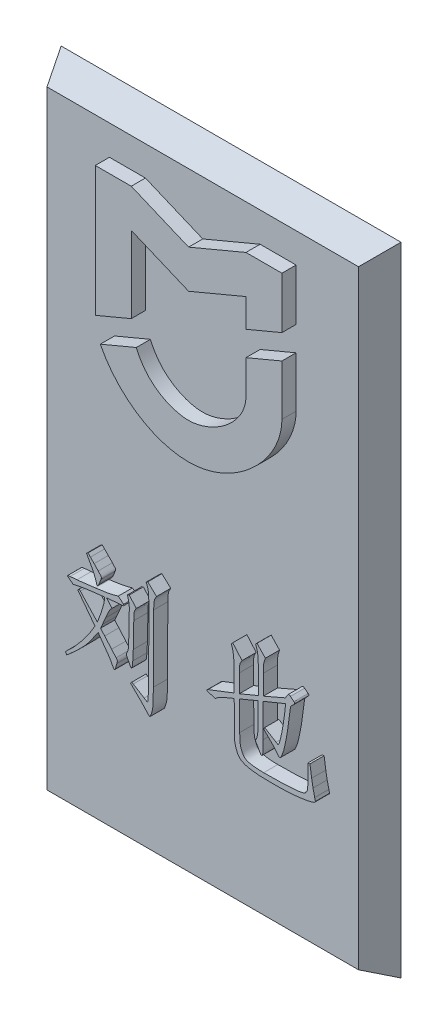
from build123d import *

# Parameters (mm, degrees)
EXTRUDE_2_DEPTH     = 1
EXTRUDE_3_DEPTH     = 1
SKETCH_5_R          = 0.4
CUT_EXTRUDE_1_DEPTH = 1


with BuildPart() as part:
    # 草图1 → 放样1 section 0
    with BuildSketch(Plane.XY):
        with BuildLine():
            Line((-12, -22.5), (12, -22.5))
            Line((12, -22.5), (12, 22.5))
            Line((12, 22.5), (-12, 22.5))
            Line((-12, 22.5), (-12, -22.5))
        make_face()
    # 草图2 → 放样1 section 1
    with BuildSketch(Plane.XY.offset(2)):
        with BuildLine():
            Line((-11, -21.5), (11, -21.5))
            Line((11, -21.5), (11, 21.5))
            Line((11, 21.5), (-11, 21.5))
            Line((-11, 21.5), (-11, -21.5))
        make_face()
    loft()

    # 草图3 → 凸台-拉伸2 (add)
    with BuildSketch(Plane.XY.offset(2)):
        Polygon((-6.59, 10.23382716), (-6.59, 19.4), (-4.05, 19.4), (0, 17.7), (4.05, 19.4), (6.59, 19.4), (6.59, 15.76617284), (4.05, 14.7), (4.05, 16.7), (0, 15), (-4.05, 16.7), (-4.05, 11.3), align=None)
        with BuildLine():
            Line((4.05, 12.964761344), (6.59, 14.030934184))
            Line((6.59, 14.030934184), (6.59, 10.459517091))
            add(Edge.make_bspline(
                [(-6.235218606, 8.64750909), (-4.870751444, 5.947394248), (1.072971475, 2.342935771), (6.59, 7.938736003), (6.59, 10.459517091)],
                knots=[0, 0, 0, 0, 0.499282993, 1, 1, 1, 1], degree=3))
            Line((-6.235218606, 8.64750909), (-3.695218606, 9.713681929))
            add(Edge.make_bspline(
                [(-3.695218606, 9.713681929), (-2.940743033, 7.888143936), (-0.801318312, 7.003787028), (2.044547534, 7.264383406), (4.05, 9.040341702), (4.05, 10.590681389)],
                knots=[0, 0, 0, 0, 0.291621451, 0.391621451, 1, 1, 1, 1], degree=3))
            Line((4.05, 10.590681389), (4.05, 12.964761344))
        make_face()
    extrude(amount=EXTRUDE_2_DEPTH)

    # 草图4 → 凸台-拉伸3 (add)
    with BuildSketch(Plane.XY.offset(2)):
        with BuildLine():
            Line((-8.701981675, -11.388663968), (-8.617600682, -11.301725975))
            add(Edge.make_bspline(
                [(-8.617600682, -11.301725975), (-8.6150409, -11.299171838), (-8.607361553, -11.291509428), (-8.591939025, -11.275812111), (-8.567531532, -11.253359072), (-8.535647603, -11.222146979), (-8.494553267, -11.183979196), (-8.445204463, -11.138285053), (-8.386816782, -11.085481715), (-8.320576955, -11.024306793), (-8.246221878, -10.954193648), (-8.165436054, -10.873388622), (-8.079020214, -10.781225902), (-7.985588416, -10.679014982), (-7.886121691, -10.565894731), (-7.778094687, -10.443997551), (-7.666436292, -10.308719395), (-7.503591424, -10.115000087), (-7.298895179, -9.854174622), (-7.06301416, -9.517669226), (-6.830626913, -9.160132218), (-6.685534688, -8.909472229), (-6.611634349, -8.781802685)],
                knots=[0, 0, 0, 0, 0.067064899, 0.201194698, 0.408053647, 0.681959008, 1.028641223, 1.448132034, 1.929283414, 2.488604495, 3.120354818, 3.824536261, 4.607279378, 5.463251305, 6.392664243, 7.400870751, 8.483674113, 9.645406679, 12.094487374, 14.629448405, 17.264597856, 20, 20, 20, 20], degree=3))
            add(Edge.make_bspline(
                [(-6.611634349, -8.781802685), (-6.677355219, -8.694080325), (-6.801336137, -8.528594101), (-6.975046697, -8.293869871), (-7.128052851, -8.089741633), (-7.260480444, -7.915569528), (-7.369897523, -7.770279599), (-7.457376329, -7.654282983), (-7.526217285, -7.570571896), (-7.582699071, -7.497799136), (-7.635586412, -7.437186854), (-7.679234592, -7.378243521), (-7.712283472, -7.338932475), (-7.724576877, -7.315079833), (-7.729043256, -7.306413808)],
                knots=[0, 0, 0, 0, 2.13149326, 4.021013283, 5.678471046, 7.092298062, 8.275727547, 9.215558715, 9.917047241, 10.382981583, 11.006899411, 11.479347563, 11.810839116, 12, 12, 12, 12], degree=3))
            Line((-7.729043256, -7.306413808), (-7.824930748, -7.177285319))
            Line((-7.824930748, -7.177285319), (-7.729043256, -7.073726827))
            Line((-7.729043256, -7.073726827), (-7.644662263, -7.15938632))
            add(Edge.make_bspline(
                [(-7.644662263, -7.15938632), (-7.629282451, -7.175972122), (-7.591954382, -7.216227229), (-7.527305195, -7.288297956), (-7.440557184, -7.379422665), (-7.302378255, -7.536292511), (-7.104572099, -7.745740062), (-6.905065826, -7.963796689), (-6.747802954, -8.136718021), (-6.635049858, -8.252099447), (-6.536865705, -8.358806964), (-6.47286159, -8.423973045), (-6.442872363, -8.454506712)],
                knots=[0, 0, 0, 0, 0.384045172, 0.932109217, 1.643764177, 2.519898478, 4.481024401, 6.534588103, 7.538259206, 8.449228042, 9.273383417, 10, 10, 10, 10], degree=3))
            add(Edge.make_bspline(
                [(-6.442872363, -8.454506712), (-6.405201527, -8.35911478), (-6.332905522, -8.176043302), (-6.231843181, -7.912276932), (-6.149864716, -7.668866252), (-6.078665366, -7.450308489), (-6.024339358, -7.258168598), (-5.98424666, -7.096326335), (-5.956943752, -6.966798323), (-5.95252254, -6.890132643), (-5.950649904, -6.857660345)],
                knots=[0, 0, 0, 0, 1.468618142, 2.818499293, 4.043910366, 5.145864078, 6.10981738, 6.901638294, 7.534781031, 8, 8, 8, 8], degree=3))
            Line((-5.950649904, -6.857660345), (-5.950649904, -6.667163861))
            Line((-5.950649904, -6.667163861), (-6.972171319, -6.788621351))
            Line((-6.972171319, -6.788621351), (-7.451608779, -6.857660345))
            Line((-7.451608779, -6.857660345), (-7.956616237, -6.952269337))
            Line((-7.956616237, -6.952269337), (-8.16117622, -6.995738334))
            Line((-8.16117622, -6.995738334), (-8.232772214, -6.935648839))
            Line((-8.232772214, -6.935648839), (-8.485915193, -6.745152355))
            add(Edge.make_bspline(
                [(-8.485915193, -6.745152355), (-8.501489303, -6.73490888), (-8.526447886, -6.718493008), (-8.558458879, -6.694799587), (-8.557568147, -6.661889169), (-8.50827822, -6.649271695), (-8.449453901, -6.63496461), (-8.393937078, -6.628338983), (-8.365736203, -6.624973365)],
                knots=[0, 0, 0, 0, 1.118768377, 1.792903396, 2.169548065, 2.763492425, 4.355951528, 6, 6, 6, 6], degree=3))
            Line((-8.365736203, -6.624973365), (-7.885020243, -6.590453867))
            add(Edge.make_bspline(
                [(-7.885020243, -6.590453867), (-7.78272737, -6.578629672), (-7.574258285, -6.5545324), (-7.256024754, -6.515654208), (-6.925643087, -6.476441077), (-6.701543082, -6.448642762), (-6.587342851, -6.43447688)],
                knots=[0, 0, 0, 0, 0.945420497, 1.926731945, 2.943473063, 4, 4, 4, 4], degree=3))
            add(Edge.make_bspline(
                [(-6.587342851, -6.43447688), (-6.495657729, -6.423413493), (-6.318882537, -6.402082524), (-6.064664904, -6.364158296), (-5.830515798, -6.327688901), (-5.617264447, -6.28984122), (-5.424834911, -6.249462361), (-5.25244094, -6.211336739), (-5.101225844, -6.169009917), (-5.008293553, -6.13818563), (-4.964926486, -6.123801406)],
                knots=[0, 0, 0, 0, 1.33948248, 2.582613925, 3.727962399, 4.776813962, 5.723648299, 6.579883267, 7.337299279, 8, 8, 8, 8], degree=3))
            Line((-4.964926486, -6.123801406), (-4.592883017, -6.44342638))
            add(Edge.make_bspline(
                [(-4.592883017, -6.44342638), (-4.586313661, -6.454610374), (-4.573704208, -6.476077324), (-4.578676747, -6.511884126), (-4.596688819, -6.541911053), (-4.618071593, -6.545302265), (-4.628681014, -6.546984871)],
                knots=[0, 0, 0, 0, 1.123791349, 2.157044512, 3.08558681, 4, 4, 4, 4], degree=3))
            Line((-4.628681014, -6.546984871), (-5.193777967, -6.590453867))
            Line((-5.193777967, -6.590453867), (-5.793394417, -6.650543362))
            Line((-5.793394417, -6.650543362), (-5.409844449, -7.099296825))
            add(Edge.make_bspline(
                [(-5.409844449, -7.099296825), (-5.449499903, -7.136079122), (-5.524000558, -7.205181979), (-5.587303376, -7.301744233), (-5.61998484, -7.37159487), (-5.641445696, -7.416701743), (-5.666890063, -7.471734749), (-5.696865722, -7.536256466), (-5.729756683, -7.61142488), (-5.766306518, -7.697074488), (-5.809177744, -7.791622756), (-5.838230924, -7.858260359), (-5.853483912, -7.893245259)],
                knots=[0, 0, 0, 0, 1.762639404, 3.311468555, 3.728776672, 4.283189535, 4.943599157, 5.710021754, 6.607881863, 7.624557154, 8.752886879, 10, 10, 10, 10], degree=3))
            Line((-5.853483912, -7.893245259), (-6.082335393, -8.411037716))
            Line((-6.082335393, -8.411037716), (-6.214020882, -8.712763691))
            Line((-6.214020882, -8.712763691), (-5.926358406, -9.049009163))
            Line((-5.926358406, -9.049009163), (-5.434135947, -9.610270616))
            Line((-5.434135947, -9.610270616), (-5.120903473, -9.973364586))
            add(Edge.make_bspline(
                [(-5.120903473, -9.973364586), (-5.108508398, -9.990363114), (-5.086163173, -10.021007216), (-5.056993841, -10.062275096), (-5.040222812, -10.096032898), (-5.029672316, -10.123584455), (-5.031655384, -10.152962114), (-5.034721662, -10.189376311), (-5.04632312, -10.236994653), (-5.055631797, -10.272143528), (-5.060813978, -10.291711059)],
                knots=[0, 0, 0, 0, 1.455215602, 2.623390349, 3.479583614, 4.066449285, 4.626074215, 5.48479686, 6.599775501, 8, 8, 8, 8], degree=3))
            Line((-5.060813978, -10.291711059), (-5.169486469, -10.663754528))
            add(Edge.make_bspline(
                [(-5.169486469, -10.663754528), (-5.174174993, -10.677157718), (-5.18246774, -10.700864381), (-5.198745873, -10.729886481), (-5.216901029, -10.749122095), (-5.238951481, -10.755125572), (-5.261594893, -10.748983909), (-5.282282348, -10.729450325), (-5.305362329, -10.7015698), (-5.3182664, -10.677293999), (-5.325463456, -10.663754528)],
                knots=[0, 0, 0, 0, 1.365122435, 2.414536923, 3.199116316, 3.836643909, 4.513934304, 5.360547298, 6.527884014, 8, 8, 8, 8], degree=3))
            Line((-5.325463456, -10.663754528), (-5.421350948, -10.482207543))
            Line((-5.421350948, -10.482207543), (-5.565821436, -10.215001065))
            add(Edge.make_bspline(
                [(-5.565821436, -10.215001065), (-5.572208548, -10.205622117), (-5.588244401, -10.182074784), (-5.616983427, -10.140250866), (-5.658060685, -10.086621593), (-5.705063521, -10.017726276), (-5.763659301, -9.936783591), (-5.830878889, -9.842211073), (-5.90903839, -9.735248117), (-5.992876265, -9.619552174), (-6.075177782, -9.503789732), (-6.150436469, -9.397555707), (-6.216408063, -9.305904078), (-6.26928579, -9.226623912), (-6.312977006, -9.16243407), (-6.347040873, -9.11293019), (-6.368573488, -9.076247309), (-6.378991259, -9.056277349), (-6.382782868, -9.049009163)],
                knots=[0, 0, 0, 0, 0.382459276, 0.960224421, 1.710024245, 2.658454337, 3.770494442, 5.077894009, 6.569008607, 8.235429148, 9.893471766, 11.356158959, 12.623493842, 13.699131709, 14.567622413, 15.240873571, 15.723711415, 16, 16, 16, 16], degree=3))
            add(Edge.make_bspline(
                [(-6.382782868, -9.049009163), (-6.416909498, -9.100552505), (-6.482944033, -9.200288127), (-6.578062572, -9.345140635), (-6.670026744, -9.477861724), (-6.753098386, -9.60222334), (-6.833596009, -9.714430579), (-6.905249148, -9.8183162), (-6.973635526, -9.91004722), (-7.058115277, -10.023697045), (-7.173217897, -10.167150414), (-7.334311928, -10.346177935), (-7.520572626, -10.54609202), (-7.728276888, -10.75445262), (-7.936900177, -10.959762036), (-8.134192485, -11.142216407), (-8.308601908, -11.29845862), (-8.42121459, -11.389077999), (-8.473130194, -11.430854464)],
                knots=[0, 0, 0, 0, 0.931745548, 1.802914179, 2.611776586, 3.365396291, 4.056858392, 4.693065683, 5.267339538, 5.781210556, 6.827513186, 8.037874439, 9.410316573, 10.945546555, 12.471773758, 13.821678912, 14.99577158, 16, 16, 16, 16], degree=3))
            Line((-8.473130194, -11.430854464), (-8.606094183, -11.534412955))
            Line((-8.606094183, -11.534412955), (-8.701981675, -11.388663968))
        make_face()
        with BuildLine():
            Line((-7.211250799, -4.630513531), (-7.103856808, -4.553803537))
            Line((-7.103856808, -4.553803537), (-6.935094822, -4.726401023))
            Line((-6.935094822, -4.726401023), (-6.671723844, -4.993607501))
            Line((-6.671723844, -4.993607501), (-6.382782868, -5.295333475))
            add(Edge.make_bspline(
                [(-6.382782868, -5.295333475), (-6.364016122, -5.315776091), (-6.328925502, -5.354000303), (-6.279962873, -5.407778928), (-6.238808393, -5.454933426), (-6.206100395, -5.495820497), (-6.179781755, -5.528336484), (-6.163263547, -5.554924513), (-6.151359602, -5.573453422), (-6.145792904, -5.602262853), (-6.166926085, -5.650051026), (-6.181777032, -5.692273105), (-6.191007884, -5.71851694)],
                knots=[0, 0, 0, 0, 1.619185606, 3.027601398, 4.244025609, 5.269295413, 6.084975465, 6.67813271, 7.10086228, 7.354451259, 8.355615234, 10, 10, 10, 10], degree=3))
            Line((-6.191007884, -5.71851694), (-6.311186874, -6.029192414))
            add(Edge.make_bspline(
                [(-6.311186874, -6.029192414), (-6.321417975, -6.053246865), (-6.339637715, -6.096083488), (-6.369175367, -6.150574851), (-6.394959287, -6.188922038), (-6.420692917, -6.212351984), (-6.449964905, -6.215095714), (-6.472643068, -6.194654532), (-6.489438739, -6.160245395), (-6.497947711, -6.131683057), (-6.502961858, -6.114851907)],
                knots=[0, 0, 0, 0, 1.766026744, 3.144973943, 4.176047435, 4.895969722, 5.415113065, 5.991050895, 6.816171035, 8, 8, 8, 8], degree=3))
            Line((-6.502961858, -6.114851907), (-6.527253356, -6.029192414))
            add(Edge.make_bspline(
                [(-6.527253356, -6.029192414), (-6.565462786, -5.913018959), (-6.64149182, -5.681857287), (-6.749621634, -5.463861832), (-6.803409333, -5.35542297)],
                knots=[0, 0, 0, 0, 1.005127315, 2, 2, 2, 2], degree=3))
            Line((-6.803409333, -5.35542297), (-6.972171319, -5.053696996))
            add(Edge.make_bspline(
                [(-6.972171319, -5.053696996), (-6.993300524, -5.01673679), (-7.030051629, -4.952450019), (-7.07406915, -4.869103457), (-7.103723446, -4.815099763), (-7.112566488, -4.786565613), (-7.115363307, -4.777541019)],
                knots=[0, 0, 0, 0, 1.639141311, 2.851042099, 3.636615117, 4, 4, 4, 4], degree=3))
            Line((-7.115363307, -4.777541019), (-7.211250799, -4.630513531))
        make_face()
        with BuildLine():
            Line((-4.31544854, -5.727466439), (-4.19526955, -5.675047944))
            Line((-4.19526955, -5.675047944), (-3.691540592, -6.245258896))
            add(Edge.make_bspline(
                [(-3.691540592, -6.245258896), (-3.709810323, -6.2727357), (-3.743306609, -6.323112515), (-3.783569559, -6.394330478), (-3.813704395, -6.452101199), (-3.834694025, -6.516023227), (-3.847448468, -6.59699214), (-3.86001522, -6.684347934), (-3.866041286, -6.771519098), (-3.870153354, -6.858037951), (-3.87038165, -6.963355521), (-3.871309223, -7.040061953), (-3.871809077, -7.081397827)],
                knots=[0, 0, 0, 0, 1.131244594, 2.0740586, 2.806258543, 3.36096166, 4.37296763, 5.611338802, 6.388280779, 7.368648685, 8.582006723, 10, 10, 10, 10], degree=3))
            Line((-3.871809077, -7.081397827), (-3.907607074, -8.859791178))
            Line((-3.907607074, -8.859791178), (-3.943405071, -9.584700618))
            add(Edge.make_bspline(
                [(-3.943405071, -9.584700618), (-3.945337151, -9.617956796), (-3.948981312, -9.680682431), (-3.95706597, -9.768414138), (-3.964171003, -9.844825772), (-3.973350685, -9.90913213), (-3.981514107, -9.961795872), (-3.991691865, -10.002621639), (-4.002479425, -10.031402593), (-4.01557264, -10.054962993), (-4.04649104, -10.064029303), (-4.079703401, -10.034802266), (-4.114163474, -9.988274594), (-4.135459361, -9.945855862), (-4.147965054, -9.92094609)],
                knots=[0, 0, 0, 0, 1.76302463, 3.325302124, 4.663004508, 5.824175704, 6.762377734, 7.484540761, 8.041647273, 8.39829817, 8.869293458, 9.507688602, 10.536427081, 12, 12, 12, 12], degree=3))
            Line((-4.147965054, -9.92094609), (-4.255359045, -9.713829107))
            Line((-4.255359045, -9.713829107), (-4.352525037, -9.532282122))
            add(Edge.make_bspline(
                [(-4.352525037, -9.532282122), (-4.365405618, -9.507749536), (-4.386757968, -9.467081464), (-4.402824564, -9.412835847), (-4.395966719, -9.373877463), (-4.383846398, -9.34036551), (-4.365738625, -9.298101457), (-4.326896416, -9.231664451), (-4.282712631, -9.130473075), (-4.25294185, -8.987201603), (-4.235786887, -8.823160753), (-4.233540193, -8.705998092), (-4.232346047, -8.643724696)],
                knots=[0, 0, 0, 0, 0.901925096, 1.495136018, 1.774437093, 2.167492218, 2.649873968, 3.26160492, 4.659748266, 6.204185153, 7.982477734, 10, 10, 10, 10], degree=3))
            Line((-4.232346047, -8.643724696), (-4.19526955, -6.814191349))
            Line((-4.19526955, -6.814191349), (-4.183763051, -6.44342638))
            add(Edge.make_bspline(
                [(-4.183763051, -6.44342638), (-4.18831572, -6.402924774), (-4.198826597, -6.309417557), (-4.215744817, -6.184916485), (-4.235127336, -6.066005847), (-4.255291323, -5.96181072), (-4.282481032, -5.84759475), (-4.304121749, -5.768739449), (-4.31544854, -5.727466439)],
                knots=[0, 0, 0, 0, 1.006347927, 2.323384265, 3.101860361, 3.981004873, 4.943254252, 6, 6, 6, 6], degree=3))
        make_face()
        with BuildLine():
            Line((-2.886085659, -4.216279565), (-2.260899212, -4.795440017))
            add(Edge.make_bspline(
                [(-2.260899212, -4.795440017), (-2.27897721, -4.825593177), (-2.31186996, -4.88045657), (-2.353740762, -4.955684025), (-2.385079585, -5.013972945), (-2.406156719, -5.061201132), (-2.418307524, -5.107926684), (-2.429878104, -5.162874149), (-2.439530387, -5.231674601), (-2.451791638, -5.345356064), (-2.462447745, -5.509089806), (-2.464411029, -5.645623695), (-2.465459195, -5.71851694)],
                knots=[0, 0, 0, 0, 1.09355359, 1.989710599, 2.677512757, 3.152714002, 3.593377568, 4.175755165, 4.899414449, 5.752884475, 7.732533383, 10, 10, 10, 10], degree=3))
            Line((-2.465459195, -5.71851694), (-2.489750693, -10.464308545))
            add(Edge.make_bspline(
                [(-2.489750693, -10.464308545), (-2.489682191, -10.492009645), (-2.489529374, -10.553807072), (-2.490975351, -10.656519076), (-2.4938808, -10.778813349), (-2.496965577, -10.96890006), (-2.502164021, -11.223356379), (-2.509750918, -11.482641294), (-2.523924139, -11.690403365), (-2.543112578, -11.841690607), (-2.577602355, -11.986608757), (-2.61808336, -12.120197835), (-2.659407718, -12.233941254), (-2.695694125, -12.314965002), (-2.715146911, -12.36969669), (-2.735761473, -12.38529897), (-2.741615172, -12.389729384)],
                knots=[0, 0, 0, 0, 0.591697287, 1.319996994, 2.194077997, 3.204678908, 5.380780365, 7.630722164, 8.744310266, 9.828297922, 10.883818306, 11.920525732, 12.813365975, 13.454079988, 13.844980897, 14, 14, 14, 14], degree=3))
            add(Edge.make_bspline(
                [(-2.741615172, -12.389729384), (-2.748580604, -12.386552763), (-2.770203473, -12.376691542), (-2.805730246, -12.342781364), (-2.857676356, -12.290296374), (-2.898439287, -12.248716896), (-2.921883657, -12.224802898)],
                knots=[0, 0, 0, 0, 0.372665578, 1.156869871, 2.364803703, 4, 4, 4, 4], degree=3))
            Line((-2.921883657, -12.224802898), (-3.35529512, -11.750479437))
            Line((-3.35529512, -11.750479437), (-3.967696569, -11.154698487))
            Line((-3.967696569, -11.154698487), (-4.099382058, -11.008949499))
            Line((-4.099382058, -11.008949499), (-4.003494566, -10.905391008))
            Line((-4.003494566, -10.905391008), (-3.907607074, -10.974430002))
            Line((-3.907607074, -10.974430002), (-3.137950139, -11.448753463))
            add(Edge.make_bspline(
                [(-3.137950139, -11.448753463), (-3.107846641, -11.467453432), (-3.055614578, -11.499899429), (-2.987095797, -11.54194895), (-2.943047018, -11.562424533), (-2.912447329, -11.578564787), (-2.894380813, -11.563642034), (-2.884389813, -11.541037572), (-2.870955086, -11.507974371), (-2.865124564, -11.480861102), (-2.861794162, -11.465373961)],
                knots=[0, 0, 0, 0, 2.231975484, 3.872662471, 4.948167798, 5.447359977, 5.773533116, 6.264068126, 7.008433082, 8, 8, 8, 8], degree=3))
            add(Edge.make_bspline(
                [(-2.861794162, -11.465373961), (-2.858514906, -11.447512726), (-2.850750002, -11.405219364), (-2.858581596, -11.328530112), (-2.859413733, -11.227473124), (-2.851781312, -11.137658333), (-2.847727937, -11.0638988), (-2.843092015, -11.012428916), (-2.84163978, -10.949676316), (-2.836799089, -10.876886425), (-2.834870732, -10.792882265), (-2.832612814, -10.698680605), (-2.827953876, -10.593893276), (-2.826668572, -10.520567804), (-2.825996165, -10.482207543)],
                knots=[0, 0, 0, 0, 0.661127957, 1.565475392, 2.796625909, 4.357721855, 4.857348772, 5.497957161, 6.246587067, 7.151605532, 8.164975693, 9.318533995, 10.597189571, 12, 12, 12, 12], degree=3))
            Line((-2.825996165, -10.482207543), (-2.801704667, -5.545919455))
            add(Edge.make_bspline(
                [(-2.801704667, -5.545919455), (-2.801760094, -5.519481806), (-2.801871949, -5.466129504), (-2.807924708, -5.396797206), (-2.810607971, -5.332810947), (-2.815391131, -5.270252602), (-2.816801137, -5.193025953), (-2.822487079, -5.073272995), (-2.829012882, -4.921239192), (-2.843980556, -4.769848285), (-2.868264302, -4.646533474), (-2.89965208, -4.540449213), (-2.942670187, -4.417885881), (-2.976551583, -4.331655482), (-2.99475815, -4.28531856)],
                knots=[0, 0, 0, 0, 0.739991118, 1.493333668, 1.947445289, 2.533295858, 3.249720848, 4.109699155, 5.890394751, 7.51137051, 8.363279193, 9.405830689, 10.605992517, 12, 12, 12, 12], degree=3))
            Line((-2.99475815, -4.28531856), (-2.886085659, -4.216279565))
        make_face()
        with BuildLine():
            Line((3.210824632, -7.962284253), (3.210824632, -6.374387385))
            add(Edge.make_bspline(
                [(3.210824632, -6.374387385), (3.209126434, -6.271656981), (3.205655579, -6.06169196), (3.187606357, -5.795820456), (3.159876337, -5.575337912), (3.126662955, -5.402164237), (3.07905803, -5.224205556), (3.038507103, -5.105465778), (3.017771149, -5.044747496)],
                knots=[0, 0, 0, 0, 1.368881025, 2.797780605, 3.547867927, 4.328518173, 5.145277974, 6, 6, 6, 6], degree=3))
            Line((3.017771149, -5.044747496), (3.11493714, -4.941189005))
            Line((3.11493714, -4.941189005), (3.774643085, -5.700617942))
            add(Edge.make_bspline(
                [(3.774643085, -5.700617942), (3.758326503, -5.725251518), (3.72796582, -5.771087843), (3.687480246, -5.836093473), (3.657878594, -5.893945094), (3.627944587, -5.964767706), (3.607082509, -6.067445774), (3.592483254, -6.208639878), (3.584038135, -6.372591178), (3.583265573, -6.487741703), (3.582868101, -6.546984871)],
                knots=[0, 0, 0, 0, 0.799333978, 1.487341208, 2.069922442, 2.555870397, 3.562491356, 4.885176502, 6.397471374, 8, 8, 8, 8], degree=3))
            Line((3.582868101, -6.546984871), (3.582868101, -7.824206265))
            Line((3.582868101, -7.824206265), (4.929128489, -7.262944811))
            Line((4.929128489, -7.262944811), (4.929128489, -5.753036437))
            add(Edge.make_bspline(
                [(4.929128489, -5.753036437), (4.92858556, -5.691244836), (4.927548375, -5.573201294), (4.927892338, -5.404804507), (4.921425798, -5.253992254), (4.915833818, -5.079927224), (4.901987045, -4.885380488), (4.875754526, -4.70123617), (4.846282377, -4.559098647), (4.815991848, -4.44684633), (4.781186889, -4.325153143), (4.751489744, -4.242540414), (4.736075005, -4.199659067)],
                knots=[0, 0, 0, 0, 1.176911092, 2.248311282, 3.206600744, 4.051334116, 5.565261425, 6.918565952, 7.590320494, 8.328559244, 9.132414199, 10, 10, 10, 10], degree=3))
            Line((4.736075005, -4.199659067), (4.831962497, -4.112721074))
            Line((4.831962497, -4.112721074), (5.421350948, -4.734072022))
            add(Edge.make_bspline(
                [(5.421350948, -4.734072022), (5.408322526, -4.770211237), (5.383317544, -4.839571927), (5.351239432, -4.940628433), (5.325704556, -5.034024238), (5.303827308, -5.126182054), (5.29141719, -5.231984471), (5.283519325, -5.364266474), (5.276614903, -5.530086504), (5.276786754, -5.652026137), (5.27688046, -5.71851694)],
                knots=[0, 0, 0, 0, 0.919393691, 1.76455914, 2.536580374, 3.236881176, 4.028858006, 5.081856361, 6.408805183, 8, 8, 8, 8], degree=3))
            Line((5.27688046, -5.71851694), (5.27688046, -7.124866823))
            Line((5.27688046, -7.124866823), (6.827700831, -6.452375879))
            Line((6.827700831, -6.452375879), (7.019475815, -6.158320903))
            add(Edge.make_bspline(
                [(7.019475815, -6.158320903), (7.026703946, -6.148697104), (7.041507275, -6.128987408), (7.086030215, -6.128122667), (7.134752872, -6.147887327), (7.168626298, -6.170689347), (7.188237801, -6.183890901)],
                knots=[0, 0, 0, 0, 0.71453755, 1.463384476, 2.53139035, 4, 4, 4, 4], degree=3))
            Line((7.188237801, -6.183890901), (7.44010228, -6.374387385))
            add(Edge.make_bspline(
                [(7.44010228, -6.374387385), (7.456409708, -6.388950822), (7.484511329, -6.414047126), (7.499338251, -6.463386598), (7.482078066, -6.498937399), (7.458599113, -6.532898791), (7.416909429, -6.570821509), (7.368574387, -6.61700621), (7.316558293, -6.66066125), (7.273659526, -6.702873709), (7.241348343, -6.736242921), (7.21701738, -6.763028278), (7.208110051, -6.796607746), (7.197737652, -6.840710682), (7.1853454, -6.906928354), (7.171491916, -6.995155013), (7.156693918, -7.104841442), (7.138517192, -7.236055278), (7.117949326, -7.388985313), (7.090185505, -7.615805341), (7.057078191, -7.895783521), (7.012200307, -8.20829562), (6.973202819, -8.482784302), (6.930564858, -8.72147271), (6.891685116, -8.932838148), (6.854222441, -9.124032539), (6.8204412, -9.299942354), (6.785589875, -9.460139588), (6.75147321, -9.607093542), (6.714601925, -9.742081558), (6.673630702, -9.866106051), (6.630965981, -9.977511831), (6.590073801, -10.073390324), (6.556322534, -10.151155796), (6.52798116, -10.209509469), (6.502502392, -10.25649485), (6.470291137, -10.298824211), (6.434831686, -10.300083455), (6.418580865, -10.300660558)],
                knots=[0, 0, 0, 0, 0.559111769, 0.963484084, 1.199679221, 1.54642562, 2.027141703, 2.640108529, 3.269336219, 3.773372396, 4.184380251, 4.473866774, 4.681914613, 5.06490853, 5.645540527, 6.411685309, 7.363818343, 8.492742829, 9.820197465, 11.333935145, 14.372292433, 17.073622702, 19.457084914, 21.504944609, 23.311490023, 24.986709407, 26.517821523, 27.920066707, 29.204667356, 30.399106788, 31.519103026, 32.563782659, 33.467986644, 34.199448975, 34.748689143, 35.126785844, 35.59981199, 36, 36, 36, 36], degree=3))
            add(Edge.make_bspline(
                [(6.418580865, -10.300660558), (6.409816095, -10.299120895), (6.389730733, -10.2955926), (6.361018096, -10.272946221), (6.329957172, -10.239895489), (6.309607694, -10.212298734), (6.298401875, -10.197102067)],
                knots=[0, 0, 0, 0, 0.646680353, 1.481933883, 2.613379931, 4, 4, 4, 4], degree=3))
            Line((6.298401875, -10.197102067), (5.973662902, -9.791817601))
            Line((5.973662902, -9.791817601), (5.613125932, -9.421052632))
            Line((5.613125932, -9.421052632), (5.301171958, -9.126997656))
            Line((5.301171958, -9.126997656), (5.372767952, -8.997869167))
            Line((5.372767952, -8.997869167), (6.178222885, -9.490091626))
            add(Edge.make_bspline(
                [(6.178222885, -9.490091626), (6.194648608, -9.501452728), (6.223636396, -9.521502575), (6.263939359, -9.544300169), (6.292140741, -9.559916984), (6.316588627, -9.565606088), (6.337826073, -9.551900936), (6.356216812, -9.525312045), (6.377768277, -9.484375663), (6.405013145, -9.426588416), (6.435086831, -9.342078206), (6.466498512, -9.224546279), (6.505581258, -9.071791979), (6.559629335, -8.822391743), (6.627938588, -8.494438642), (6.679128713, -8.166876704), (6.712451994, -7.922564919), (6.736216622, -7.763771542), (6.754851776, -7.626833399), (6.773152012, -7.502512968), (6.791650807, -7.370998623), (6.808587871, -7.212279497), (6.829172257, -7.017111291), (6.843144072, -6.874717856), (6.850713829, -6.79757085)],
                knots=[0, 0, 0, 0, 0.440323242, 0.777073662, 1.016577932, 1.15873692, 1.297439592, 1.538046727, 1.870179391, 2.315683085, 2.945720451, 3.843830757, 4.996709113, 6.421182702, 9.468416178, 12.379641864, 13.726774567, 14.903855726, 15.918856624, 16.773102867, 17.673862327, 18.846135373, 20.291275087, 22, 22, 22, 22], degree=3))
            Line((6.850713829, -6.79757085), (5.265373961, -7.444491796))
            Line((5.265373961, -7.444491796), (5.265373961, -9.791817601))
            add(Edge.make_bspline(
                [(5.265373961, -9.791817601), (5.265651609, -9.854466389), (5.266174824, -9.972525423), (5.262737996, -10.139142222), (5.260821378, -10.284490155), (5.256968943, -10.408939518), (5.252241525, -10.512134297), (5.245890952, -10.594396297), (5.239366722, -10.655676085), (5.228165992, -10.706277228), (5.212924944, -10.748283526), (5.195840814, -10.782707572), (5.178343387, -10.807366528), (5.163005445, -10.808881042), (5.15670147, -10.809503516)],
                knots=[0, 0, 0, 0, 2.150659061, 4.052827516, 5.720942216, 7.140763154, 8.327264278, 9.266458778, 9.974179908, 10.439139188, 11.045371919, 11.490336149, 11.790525499, 12, 12, 12, 12], degree=3))
            add(Edge.make_bspline(
                [(5.15670147, -10.809503516), (5.145084644, -10.806090327), (5.115477873, -10.797391438), (5.079860637, -10.750467384), (5.03411576, -10.687163889), (5.00555075, -10.633226562), (4.989217984, -10.602386533)],
                knots=[0, 0, 0, 0, 0.521855015, 1.330005405, 2.473363152, 4, 4, 4, 4], degree=3))
            Line((4.989217984, -10.602386533), (4.831962497, -10.318559557))
            add(Edge.make_bspline(
                [(4.831962497, -10.318559557), (4.816647756, -10.292605327), (4.789719584, -10.24696956), (4.754513798, -10.187356703), (4.736850566, -10.14424678), (4.726676087, -10.112382083), (4.737698822, -10.086419896), (4.74847026, -10.055251845), (4.766358044, -10.014895421), (4.792389019, -9.966324018), (4.818368235, -9.903962994), (4.840282152, -9.826694947), (4.859466062, -9.734353684), (4.874221519, -9.632559334), (4.888087211, -9.531143226), (4.897628983, -9.441089287), (4.906229205, -9.367479809), (4.910466321, -9.300917129), (4.912987062, -9.222899108), (4.915654365, -9.115933767), (4.916598437, -8.970595453), (4.916435041, -8.861069343), (4.91634349, -8.799701683)],
                knots=[0, 0, 0, 0, 1.153316831, 2.027896723, 2.626604535, 2.958707876, 3.24723816, 3.664596661, 4.233327129, 4.925102638, 5.771803346, 6.807388563, 7.988979107, 9.373009111, 10.736290758, 11.899678417, 12.832920397, 13.567268629, 14.447137605, 15.815272531, 17.655290347, 20, 20, 20, 20], degree=3))
            Line((4.91634349, -8.799701683), (4.91634349, -7.582569785))
            Line((4.91634349, -7.582569785), (3.5943746, -8.134881739))
            Line((3.5943746, -8.134881739), (3.607159599, -10.188152568))
            add(Edge.make_bspline(
                [(3.607159599, -10.188152568), (3.609155134, -10.284053774), (3.613328035, -10.484594624), (3.628018181, -10.739684973), (3.658403283, -10.954775715), (3.708894856, -11.120409554), (3.779909349, -11.287863294), (3.8493934, -11.431707783), (3.937255351, -11.541708253), (4.041768254, -11.608686369), (4.174288903, -11.66793349), (4.339417769, -11.712353392), (4.53435378, -11.751593078), (4.762088112, -11.774427082), (5.02090097, -11.7920111), (5.204392162, -11.793279457), (5.301171958, -11.793948434)],
                knots=[0, 0, 0, 0, 1.425456696, 2.980799826, 3.795017339, 4.646697254, 5.544056949, 6.498866747, 7.011340332, 7.612152063, 8.320781704, 9.164607943, 10.145811148, 11.273905285, 12.562160463, 14, 14, 14, 14], degree=3))
            add(Edge.make_bspline(
                [(5.301171958, -11.793948434), (5.470789115, -11.794515515), (5.804503094, -11.79563122), (6.297213468, -11.787554868), (6.774213208, -11.772892278), (7.15857007, -11.752473046), (7.447605944, -11.73307115), (7.6382032, -11.714011088), (7.8043043, -11.691920919), (7.945776182, -11.664672643), (8.063545394, -11.637033396), (8.156964339, -11.603728141), (8.228035826, -11.569073121), (8.286855914, -11.514670336), (8.330260992, -11.44272668), (8.374041165, -11.363231496), (8.402674496, -11.284695978), (8.409655582, -11.232450653), (8.413040699, -11.207116983)],
                knots=[0, 0, 0, 0, 2.420504351, 4.762231322, 7.03186758, 9.2303889, 10.254712443, 11.165461446, 11.963621161, 12.644686658, 13.221420043, 13.686975695, 14.059747789, 14.339570671, 14.816933281, 15.24945927, 15.636064052, 16, 16, 16, 16], degree=3))
            Line((8.413040699, -11.207116983), (8.425825698, -9.635840614))
            Line((8.425825698, -9.635840614), (8.569017686, -9.619220115))
            Line((8.569017686, -9.619220115), (8.689196676, -10.438738547))
            Line((8.689196676, -10.438738547), (8.786362668, -10.991050501))
            Line((8.786362668, -10.991050501), (8.906541658, -11.508842958))
            add(Edge.make_bspline(
                [(8.906541658, -11.508842958), (8.908298872, -11.526376634), (8.912419079, -11.567488534), (8.928010183, -11.628304071), (8.946344796, -11.68162792), (8.951917027, -11.713778718), (8.953846154, -11.72490944)],
                knots=[0, 0, 0, 0, 0.953220718, 2.235054002, 3.388969388, 4, 4, 4, 4], degree=3))
            add(Edge.make_bspline(
                [(8.953846154, -11.72490944), (8.950069463, -11.736983143), (8.941712863, -11.763698363), (8.904645101, -11.795045339), (8.856434737, -11.82724415), (8.789371367, -11.855267017), (8.707715764, -11.884867177), (8.608460275, -11.912549262), (8.492372402, -11.939047729), (8.317130483, -11.971835273), (8.091894188, -12.009785756), (7.825098208, -12.045368552), (7.569274082, -12.078985841), (7.359310107, -12.098316431), (7.186183001, -12.110551033), (7.041252135, -12.117909869), (6.879727276, -12.124408997), (6.70198161, -12.128874983), (6.507684288, -12.134990279), (6.29669265, -12.136283727), (6.069134417, -12.139943667), (5.911870583, -12.139416346), (5.830470914, -12.139143405)],
                knots=[0, 0, 0, 0, 0.232926519, 0.515391414, 0.878795428, 1.325768791, 1.869100865, 2.508894764, 3.255029941, 4.101143149, 5.850638678, 7.536402802, 9.14670046, 10.687374927, 11.488261288, 12.400303648, 13.407749454, 14.51872378, 15.733519881, 17.051853478, 18.474041082, 20, 20, 20, 20], degree=3))
            add(Edge.make_bspline(
                [(5.830470914, -12.139143405), (5.749499846, -12.139378112), (5.591382586, -12.13983644), (5.360320443, -12.136582645), (5.141722252, -12.126795164), (4.935319262, -12.116184546), (4.741261185, -12.099891372), (4.559842862, -12.07740414), (4.390691678, -12.054235165), (4.234594957, -12.024596436), (4.091014932, -11.991286754), (3.960984602, -11.94893976), (3.843915713, -11.899325014), (3.74012297, -11.84200252), (3.649680107, -11.778015545), (3.572517953, -11.706759318), (3.509301087, -11.627469309), (3.447456445, -11.513961696), (3.388881158, -11.37449272), (3.328227496, -11.217719964), (3.287009221, -11.074340979), (3.260759296, -10.939508324), (3.249330552, -10.801128193), (3.240759072, -10.64807565), (3.233684411, -10.473317947), (3.233784497, -10.349677339), (3.233837631, -10.28404006)],
                knots=[0, 0, 0, 0, 1.518911959, 2.966074195, 4.334239857, 5.623327299, 6.842892953, 7.986185861, 9.05230548, 10.044787367, 10.965795675, 11.815222499, 12.606695946, 13.347450692, 14.035144098, 14.679960432, 15.31171039, 15.927477056, 17.09794899, 18.147758735, 19.078945764, 19.892674845, 20.719956626, 21.68090022, 22.768855931, 24, 24, 24, 24], degree=3))
            Line((3.233837631, -10.28404006), (3.222331131, -8.289580226))
            add(Edge.make_bspline(
                [(3.222331131, -8.289580226), (3.159695497, -8.315601661), (3.040781697, -8.365003374), (2.871626836, -8.434819669), (2.722994747, -8.499134877), (2.593460017, -8.553589381), (2.484240181, -8.601604607), (2.394031785, -8.640580012), (2.323583949, -8.672308254), (2.254988923, -8.705658648), (2.17860888, -8.74665373), (2.088638186, -8.806853655), (1.989717119, -8.87517737), (1.923522055, -8.927171092), (1.888855743, -8.95440017)],
                knots=[0, 0, 0, 0, 1.631833046, 3.098036258, 4.40260852, 5.528124467, 6.478632526, 7.272971962, 7.892419543, 8.33722278, 9.108053839, 9.975462267, 10.9397509, 12, 12, 12, 12], degree=3))
            Line((1.888855743, -8.95440017), (1.383848285, -8.816322182))
            add(Edge.make_bspline(
                [(1.383848285, -8.816322182), (1.371256566, -8.813541672), (1.349110971, -8.808651471), (1.321910173, -8.794053216), (1.302807026, -8.775950203), (1.297801439, -8.751917852), (1.303225753, -8.727242926), (1.321967909, -8.705700487), (1.34822781, -8.684206509), (1.37110556, -8.674629187), (1.383848285, -8.669294694)],
                knots=[0, 0, 0, 0, 1.286068791, 2.261864203, 3.078608935, 3.825212105, 4.613490036, 5.528387975, 6.623331777, 8, 8, 8, 8], degree=3))
            Line((1.383848285, -8.669294694), (3.210824632, -7.962284253))
        make_face()
    extrude(amount=EXTRUDE_3_DEPTH)

    # 草图5 → 切除-拉伸1 (cut)
    with BuildSketch(Plane(origin=(0, 0, 0), x_dir=(-1, 0, 0), z_dir=(0, 0, -1))):
        with Locations((-8, 14.5)):
            Circle(SKETCH_5_R)
        with Locations((8, 14.5)):
            Circle(SKETCH_5_R)
        with Locations((-8, -14.5)):
            Circle(SKETCH_5_R)
        with Locations((8, -14.5)):
            Circle(SKETCH_5_R)
    extrude(amount=-CUT_EXTRUDE_1_DEPTH, mode=Mode.SUBTRACT)


solid = part.part
